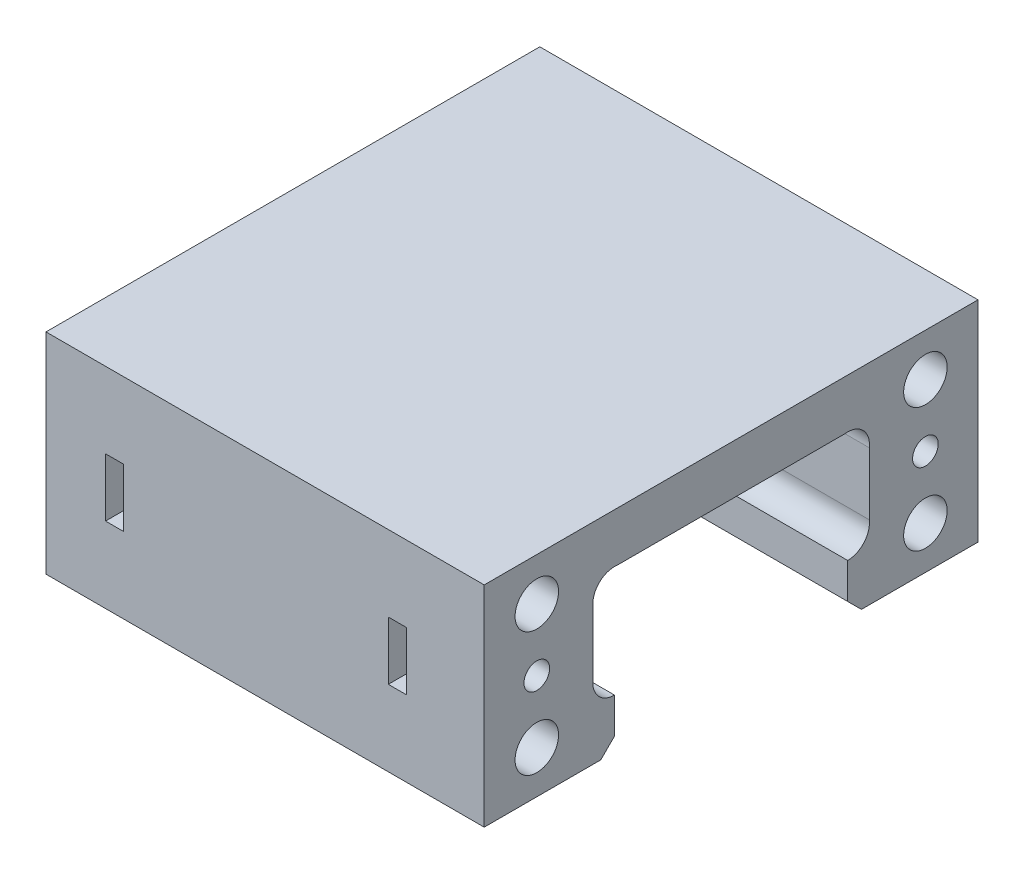
from build123d import *

# Parameters (mm, degrees)
SKETCH2_R           = 2.778125
BOSS_EXTRUDE2_DEPTH = 56.3835756
SKETCH3_R           = 1.651
CUT_EXTRUDE1_DEPTH  = 22.1668
SKETCH4_W           = 10.767766953
SKETCH4_H           = 2.34
CUT_EXTRUDE2_DEPTH  = 3.75
SKETCH5_R           = 2.8
CUT_EXTRUDE3_DEPTH  = 80.995318373


with BuildPart() as part:
    # Sketch2 → Boss-Extrude2 (new body)
    with BuildSketch(Plane(origin=(0, 0, 0), x_dir=(0, 0, -1), z_dir=(1, 0, 0))):
        with BuildLine():
            Line((0, 25.778125), (30, 25.778125))
            ThreePointArc((30, 25.778125), (31.964431026, 24.964431026), (32.778125, 23))
            Line((32.778125, 23), (32.778125, 14.278125))
            ThreePointArc((32.778125, 14.278125), (31.964431026, 12.313693974), (30, 11.5))
            Line((30, 11.5), (30, 6.906829453))
            Line((30, 6.906829453), (31.767766953, 5.1390625))
            Line((31.767766953, 5.1390625), (46.767766953, 5.1390625))
            Line((46.767766953, 5.1390625), (46.767766953, 32.1390625))
            Line((46.767766953, 32.1390625), (-16.767766953, 32.1390625))
            Line((-16.767766953, 32.1390625), (-16.767766953, 5.1390625))
            Line((-16.767766953, 5.1390625), (-1.767766953, 5.1390625))
            Line((-1.767766953, 5.1390625), (0, 6.906829453))
            Line((0, 6.906829453), (0, 11.5))
            ThreePointArc((0, 11.5), (-1.964431026, 12.313693974), (-2.778125, 14.278125))
            Line((-2.778125, 14.278125), (-2.778125, 23))
            ThreePointArc((-2.778125, 23), (-1.964431026, 24.964431026), (0, 25.778125))
        make_face()
        with Locations((-10, 26.6390625)):
            Circle(SKETCH2_R, mode=Mode.SUBTRACT)
        with Locations((-10, 10.6390625)):
            Circle(SKETCH2_R, mode=Mode.SUBTRACT)
        with Locations((40, 10.6390625)):
            Circle(SKETCH2_R, mode=Mode.SUBTRACT)
        with Locations((40, 26.6390625)):
            Circle(SKETCH2_R, mode=Mode.SUBTRACT)
    extrude(amount=BOSS_EXTRUDE2_DEPTH)

    # Sketch3 → Cut-Extrude1 (cut)
    with BuildSketch(Plane(origin=(56.3835756, 0, 0), x_dir=(0, 0, -1), z_dir=(1, 0, 0))):
        with Locations((-10, 18.6390625)):
            Circle(SKETCH3_R)
        with Locations((40, 18.6390625)):
            Circle(SKETCH3_R)
    cut_extrude1 = extrude(amount=-CUT_EXTRUDE1_DEPTH, mode=Mode.SUBTRACT)

    # Sketch4 → Cut-Extrude2 (cut, symmetric)
    with BuildSketch(Plane(origin=(0, 18.6390625, 0), x_dir=(0, 0, -1), z_dir=(0, -1, 0))):
        with Locations((-11.383883477, 45.2135756)):
            Rectangle(SKETCH4_W, SKETCH4_H)
        with Locations((41.383883477, 45.2135756)):
            Rectangle(SKETCH4_W, SKETCH4_H)
        with Locations((-11.383883477, 8.83)):
            Rectangle(SKETCH4_W, SKETCH4_H)
        with Locations((41.383883477, 8.83)):
            Rectangle(SKETCH4_W, SKETCH4_H)
    extrude(amount=CUT_EXTRUDE2_DEPTH, both=True, mode=Mode.SUBTRACT)

    # Sketch5 → Cut-Extrude3 (cut, through all)
    with BuildSketch(Plane(origin=(56.3835756, 0, 0), x_dir=(0, 0, -1), z_dir=(1, 0, 0))):
        with Locations((-10, 26.6390625)):
            Circle(SKETCH5_R)
        with Locations((0, 23)):
            Circle(SKETCH5_R)
        with Locations((-10, 10.6390625)):
            Circle(SKETCH5_R)
        with Locations((40, 26.6390625)):
            Circle(SKETCH5_R)
        with Locations((40, 10.6390625)):
            Circle(SKETCH5_R)
        with Locations((30, 23)):
            Circle(SKETCH5_R)
        with Locations((0, 14.278125)):
            Circle(SKETCH5_R)
        with Locations((30, 14.278125)):
            Circle(SKETCH5_R)
    extrude(amount=-CUT_EXTRUDE3_DEPTH, mode=Mode.SUBTRACT)

    # Mirror1: Cut-Extrude1 across plane
    add(cut_extrude1.mirror(Plane.ZY.offset(-28.1917878)), mode=Mode.SUBTRACT)


solid = part.part
